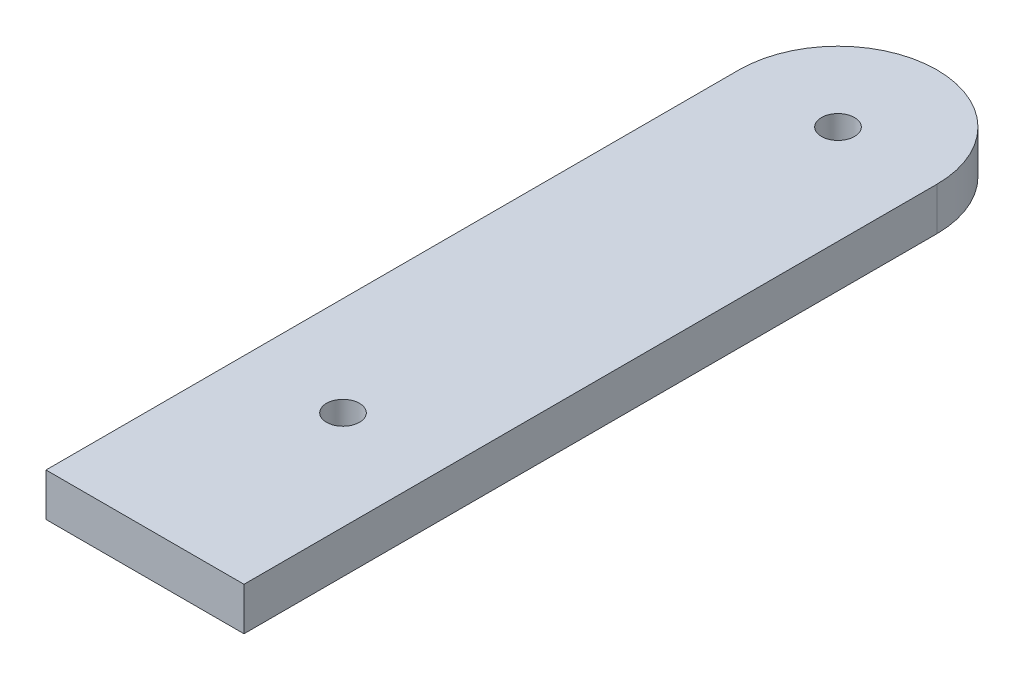
from build123d import *

# Parameters (mm, degrees)
SKETCH1_W           = 30
SKETCH1_H           = 120
SKETCH1_R           = 2.5
BOSS_EXTRUDE1_DEPTH = 6.5
FILLET1_R           = 15


with BuildPart() as part:
    # Sketch1 → Boss-Extrude1 (new body)
    with BuildSketch(Plane(origin=(0, 0, 0), x_dir=(1, 0, 0), z_dir=(0, 1, 0))):
        with Locations((15, 60)):
            Rectangle(SKETCH1_W, SKETCH1_H)
        with Locations(Location((15, 30, 0), (0, 0, 90))):
            Circle(SKETCH1_R, mode=Mode.SUBTRACT)
        with Locations(Location((15, 105, 0), (0, 0, 90))):
            Circle(SKETCH1_R, mode=Mode.SUBTRACT)
    extrude(amount=BOSS_EXTRUDE1_DEPTH)

    # Fillet1
    fillet1_edges = [part.edges().sort_by_distance(p)[0] for p in [
        (30, 3.25, -120),
        (0, 3.25, -120),
    ]]
    fillet(fillet1_edges, radius=FILLET1_R - 0.0001)  # a hair under: the kernel refuses the full size


solid = part.part
